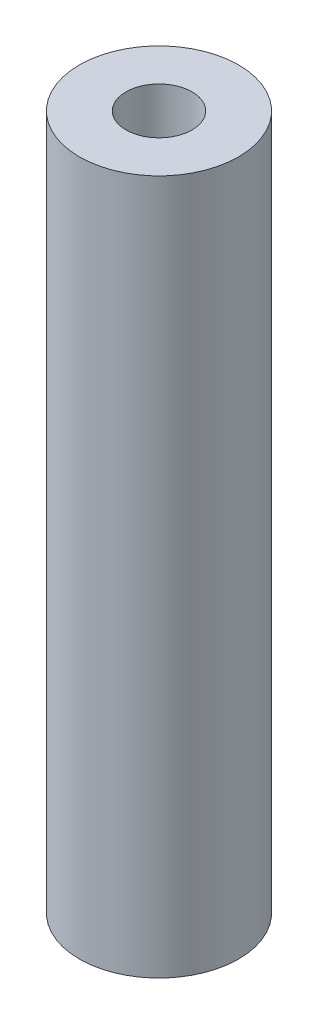
from build123d import *

# Parameters (mm, degrees)
SKETCH1_R           = 7.415
SKETCH1_R_2         = 3.075
BOSS_EXTRUDE1_DEPTH = 64.7


with BuildPart() as part:
    # Sketch1 → Boss-Extrude1 (new body)
    with BuildSketch(Plane(origin=(0, 0, 0), x_dir=(1, 0, 0), z_dir=(0, 1, 0))):
        Circle(SKETCH1_R)
        Circle(SKETCH1_R_2, mode=Mode.SUBTRACT)
    extrude(amount=BOSS_EXTRUDE1_DEPTH)


solid = part.part
